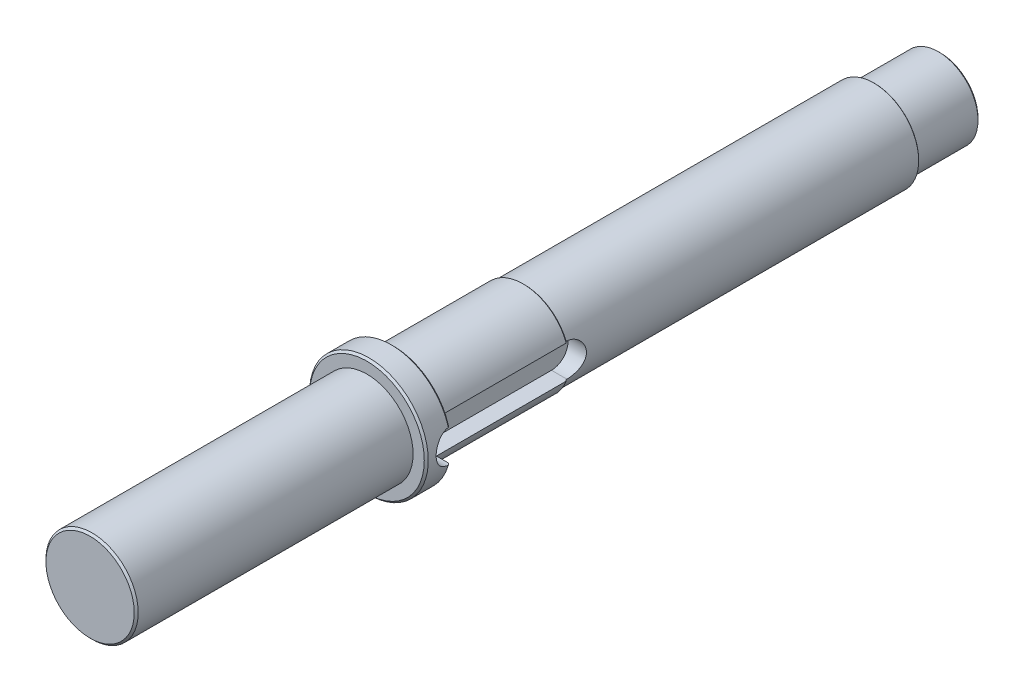
from build123d import *

# Parameters (mm, degrees)
SKETCH1_R         = 7
EXTRUDE1_DEPTH    = 129
EXTRUDE2_START    = -46
SKETCH2_R         = 9
EXTRUDE2_DEPTH    = 4
EXTRUDE3_START    = 4
EXTRUDE3_DEPTH    = 126.626386203
SKETCH4_OUTSIDE_W = 46.298
SKETCH4_OUTSIDE_H = 46.298
SKETCH4_OUTSIDE_R = 6
EXTRUDE4_DEPTH    = 10
CHAMFER1_SIZE     = 0.3
SKETCH5_OUTSIDE_W = 46.298
SKETCH5_OUTSIDE_H = 46.298
SKETCH5_OUTSIDE_R = 6.8
EXTRUDE5_DEPTH    = 63
CHAMFER2_SIZE     = 0.3


with BuildPart() as part:
    # Sketch1 → Extrude1 (new body)
    with BuildSketch(Plane.XY):
        Circle(SKETCH1_R)
    extrude(amount=EXTRUDE1_DEPTH)

    # Sketch2 → Extrude2 (add)
    with BuildSketch(Plane.XY.offset(129).offset(EXTRUDE2_START)):
        Circle(SKETCH2_R)
    extrude(amount=EXTRUDE2_DEPTH)

    # Sketch3 → Extrude3 (cut, through all)
    with BuildSketch(Plane(origin=(0, 0, 0), x_dir=(0, 0, -1), z_dir=(1, 0, 0)).offset(EXTRUDE3_START)):
        with BuildLine():
            Line((-83, 2.5), (-63, 2.5))
            ThreePointArc((-63, 2.5), (-60.5, 0), (-63, -2.5))
            Line((-63, -2.5), (-83, -2.5))
            ThreePointArc((-83, -2.5), (-85.5, 0), (-83, 2.5))
        make_face()
    extrude(amount=EXTRUDE3_DEPTH, mode=Mode.SUBTRACT)

    # Sketch4 outside → Extrude4 (cut)
    with BuildSketch(Plane(origin=(0, 0, 0), x_dir=(-1, 0, 0), z_dir=(0, 0, -1))):
        Rectangle(SKETCH4_OUTSIDE_W, SKETCH4_OUTSIDE_H)
        Circle(SKETCH4_OUTSIDE_R, mode=Mode.SUBTRACT)
    extrude(amount=-EXTRUDE4_DEPTH, mode=Mode.SUBTRACT)

    # Chamfer1
    chamfer1_edges = [part.edges().sort_by_distance(p)[0] for p in [
        (6, 0, 0),
        (-7, 0, 129),
        (-9, 0, 87),
        (-9, 0, 83),
        (-7, 0, 10),
    ]]
    chamfer(chamfer1_edges, length=CHAMFER1_SIZE)

    # Sketch5 outside → Extrude5 (cut)
    with BuildSketch(Plane(origin=(0, 0, 0), x_dir=(-1, 0, 0), z_dir=(0, 0, -1))):
        Rectangle(SKETCH5_OUTSIDE_W, SKETCH5_OUTSIDE_H)
        with Locations(Location((0, 0, 0), (0, 0, 158.429421698))):
            Circle(SKETCH5_OUTSIDE_R, mode=Mode.SUBTRACT)
    extrude(amount=-EXTRUDE5_DEPTH, mode=Mode.SUBTRACT)

    # Chamfer2
    # the kernel refuses this chamfer: 0.3 mm, written as the material it takes off along each edge
    with BuildSketch(Plane(origin=(0, 0, 63), x_dir=(0.9678051111401075, -0.25170074861049596, 0), z_dir=(0.25170074861049596, 0.9678051111401075, 0))) as chamfer2_piece_1_section:
        Polygon((7, -CHAMFER2_SIZE), (7 - CHAMFER2_SIZE, 0), (7, 0), align=None)
    chamfer2_piece_1 = revolve(axis=Axis((0, 0, 63), (0, 0, -1)), revolution_arc=330.843646851, mode=Mode.PRIVATE)
    chamfer2_piece_1 = chamfer2_piece_1 - Plane(origin=(0, 0, 63.195747315), x_dir=(0.9299653972776295, 0.36764705882987936, 0), z_dir=(0, 0, -1)) * Cylinder(6.8, 28, mode=Mode.PRIVATE)
    add(chamfer2_piece_1, mode=Mode.SUBTRACT)


solid = part.part
